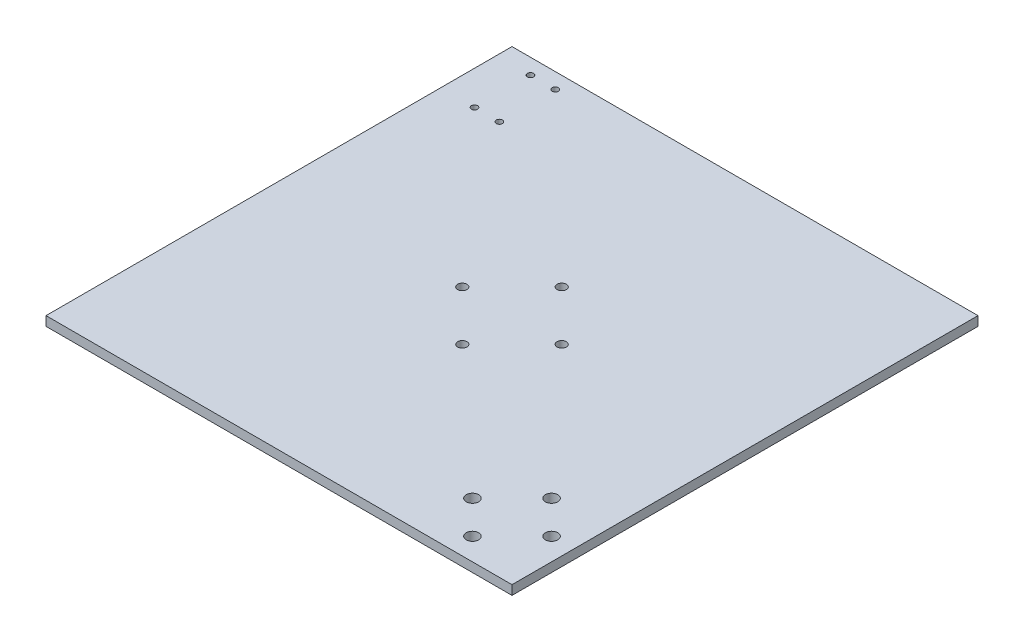
from build123d import *

# Parameters (mm, degrees)
SKETCH1_W           = 150
SKETCH1_H           = 150
BOSS_EXTRUDE1_DEPTH = 3
SKETCH2_R           = 1.5
SKETCH2_R_2         = 1
CUT_EXTRUDE1_DEPTH  = 10
SKETCH5_R           = 2
CUT_EXTRUDE2_DEPTH  = 10


with BuildPart() as part:
    # Sketch1 → Boss-Extrude1 (new body)
    with BuildSketch(Plane(origin=(0, 0, 0), x_dir=(1, 0, 0), z_dir=(0, 1, 0))):
        with Locations((75, 75)):
            Rectangle(SKETCH1_W, SKETCH1_H)
    extrude(amount=BOSS_EXTRUDE1_DEPTH)

    # Sketch2 → Cut-Extrude1 (cut)
    with BuildSketch(Plane(origin=(0, 3, 0), x_dir=(1, 0, 0), z_dir=(0, 1, 0))):
        with Locations((75, 59)):
            Circle(SKETCH2_R)
        with Locations((59, 75)):
            Circle(SKETCH2_R)
        with Locations((75, 91)):
            Circle(SKETCH2_R)
        with Locations((91, 75)):
            Circle(SKETCH2_R)
        with Locations((18.93, 145)):
            Circle(SKETCH2_R_2)
        with Locations((10.93, 145)):
            Circle(SKETCH2_R_2)
        with Locations((18.93, 127)):
            Circle(SKETCH2_R_2)
        with Locations((10.93, 127)):
            Circle(SKETCH2_R_2)
    extrude(amount=-CUT_EXTRUDE1_DEPTH, mode=Mode.SUBTRACT)

    # Sketch5 → Cut-Extrude2 (cut)
    with BuildSketch(Plane(origin=(0, 3, 0), x_dir=(1, 0, 0), z_dir=(0, 1, 0))):
        with Locations((132.275691154, 30.452272789)):
            Circle(SKETCH5_R)
        with Locations((119.547769092, 17.724350728)):
            Circle(SKETCH5_R)
        with Locations((130.15437081, 7.11774901)):
            Circle(SKETCH5_R)
        with Locations((142.882292871, 19.845671071)):
            Circle(SKETCH5_R)
    extrude(amount=-CUT_EXTRUDE2_DEPTH, mode=Mode.SUBTRACT)


solid = part.part
